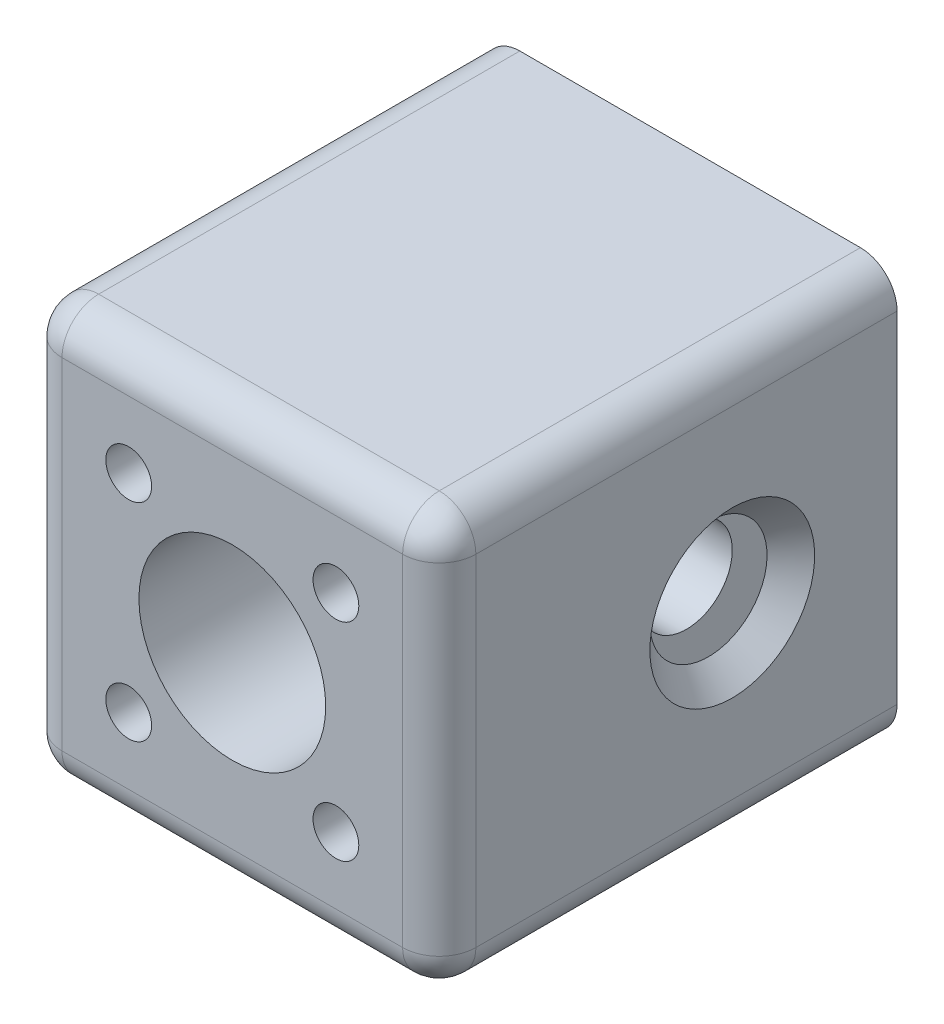
from build123d import *

# Parameters (mm, degrees)
CROQUIS1_W              = 22.6
CROQUIS1_H              = 22.6
SALIENTE_EXTRUIR1_DEPTH = 25
CROQUIS2_R              = 5.1
CORTAR_EXTRUIR1_DEPTH   = 30.671198156
CROQUIS3_R              = 1.25
CORTAR_EXTRUIR2_DEPTH   = 30.671198156
CROQUIS4_W              = 20
CROQUIS4_H              = 20
CROQUIS4_W_2            = 17.6
CROQUIS4_H_2            = 17.6
CORTAR_EXTRUIR3_DEPTH   = 15
CROQUIS5_R              = 2.5
CORTAR_EXTRUIR4_DEPTH   = 36.545041848
CHAFL_N1_SIZE           = 2
REDONDEO1_R             = 2
REDONDEO2_R             = 2


with BuildPart() as part:
    # Croquis1 → Saliente-Extruir1 (new body)
    with BuildSketch(Plane.XY):
        Rectangle(CROQUIS1_W, CROQUIS1_H)
    extrude(amount=SALIENTE_EXTRUIR1_DEPTH)

    # Croquis2 → Cortar-Extruir1 (cut, through all)
    with BuildSketch(Plane.XY.offset(25)):
        Circle(CROQUIS2_R)
    extrude(amount=-CORTAR_EXTRUIR1_DEPTH, mode=Mode.SUBTRACT)

    # Croquis3 → Cortar-Extruir2 (cut, through all)
    with BuildSketch(Plane.XY.offset(25)):
        with Locations((5.656854249, 5.656854249)):
            Circle(CROQUIS3_R)
        with Locations((5.656854249, -5.656854249)):
            Circle(CROQUIS3_R)
        with Locations((-5.656854249, -5.656854249)):
            Circle(CROQUIS3_R)
        with Locations((-5.656854249, 5.656854249)):
            Circle(CROQUIS3_R)
    extrude(amount=-CORTAR_EXTRUIR2_DEPTH, mode=Mode.SUBTRACT)

    # Croquis4 → Cortar-Extruir3 (cut)
    with BuildSketch(Plane(origin=(0, 0, 0), x_dir=(-1, 0, 0), z_dir=(0, 0, -1))):
        Rectangle(CROQUIS4_W, CROQUIS4_H)
        Rectangle(CROQUIS4_W_2, CROQUIS4_H_2, mode=Mode.SUBTRACT)
    extrude(amount=-CORTAR_EXTRUIR3_DEPTH, mode=Mode.SUBTRACT)

    # Croquis5 → Cortar-Extruir4 (cut, through all)
    with BuildSketch(Plane(origin=(11.3, 0, 0), x_dir=(0, 0, -1), z_dir=(1, 0, 0))):
        with Locations(Location((-9, 0, 0), (0, 0, 90))):
            Circle(CROQUIS5_R)
    extrude(amount=-CORTAR_EXTRUIR4_DEPTH, mode=Mode.SUBTRACT)

    # Chaflán1
    # the kernel refuses this chamfer: 2 mm, written as the material it takes off along each edge
    with BuildSketch(Plane(origin=(-11.3, 0, 9), x_dir=(0, 1, 0), z_dir=(0, 0, -1))) as chafl_n1_piece_1:
        Polygon((2.5 + CHAFL_N1_SIZE, 0), (2.5, CHAFL_N1_SIZE), (2.5, 0), align=None)
    revolve(axis=Axis((-11.3, 0, 9), (1, 0, 0)), mode=Mode.SUBTRACT)
    with BuildSketch(Plane(origin=(11.3, 0, 9), x_dir=(0, 1, 0), z_dir=(0, 0, -1))) as chafl_n1_piece_2:
        Polygon((2.5 + CHAFL_N1_SIZE, 0), (2.5, -CHAFL_N1_SIZE), (2.5, 0), align=None)
    revolve(axis=Axis((11.3, 0, 9), (1, 0, 0)), mode=Mode.SUBTRACT)

    # Redondeo1
    redondeo1_edges = [part.edges().sort_by_distance(p)[0] for p in [
        (11.3, -11.3, 12.5),
        (-11.3, -11.3, 12.5),
        (-11.3, 11.3, 12.5),
        (11.3, 11.3, 12.5),
    ]]
    fillet(redondeo1_edges, radius=REDONDEO1_R)

    # Redondeo2
    redondeo2_edges = [part.edges().sort_by_distance(p)[0] for p in [
        (0, -11.3, 25),
        (-11.3, 0, 25),
        (11.3, 0, 25),
        (0, 11.3, 25),
        (10.714213562, 10.714213562, 25),
        (-10.714213562, 10.714213562, 25),
        (10.714213562, -10.714213562, 25),
        (-10.714213562, -10.714213562, 25),
    ]]
    fillet(redondeo2_edges, radius=REDONDEO2_R)


solid = part.part
